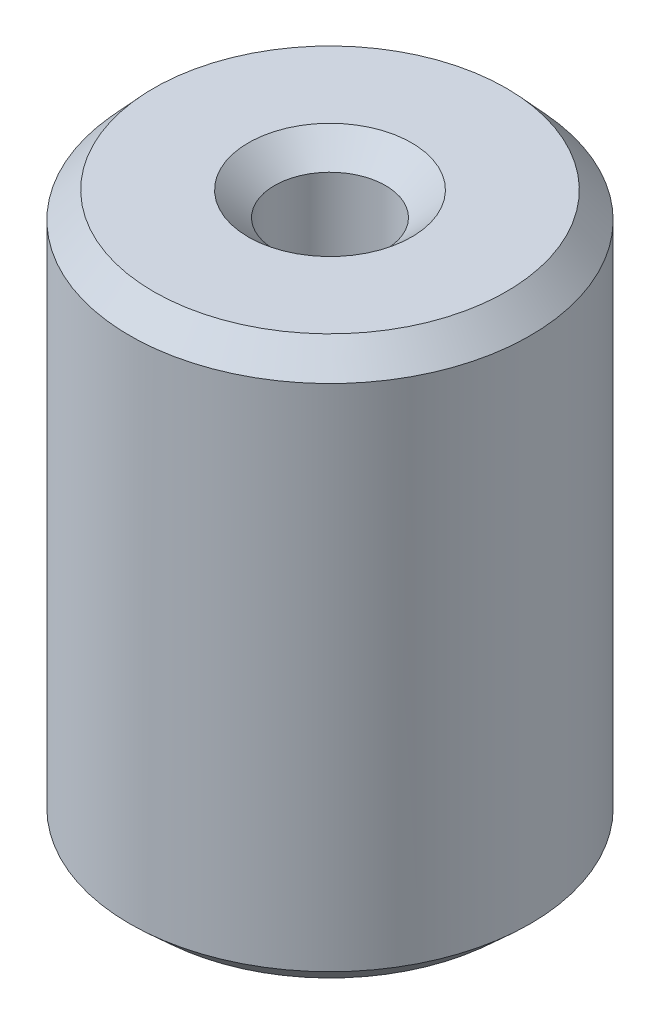
from build123d import *
from OCP.BRepFilletAPI import BRepFilletAPI_MakeChamfer

# Parameters (mm, degrees)
SKETCH1_R           = 5
BOSS_EXTRUDE1_DEPTH = 13.969813357
SKETCH2_R           = 1.386375293
CUT_EXTRUDE1_DEPTH  = 16.657448235
CHAMFER1_SIZE       = 0.652464638
CHAMFER1_SIZE2      = 0.597497914


with BuildPart() as part:
    # Sketch1 → Boss-Extrude1 (new body)
    with BuildSketch(Plane(origin=(0, 0, 0), x_dir=(1, 0, 0), z_dir=(0, 1, 0))):
        Circle(SKETCH1_R)
    extrude(amount=BOSS_EXTRUDE1_DEPTH)

    # Sketch2 → Cut-Extrude1 (cut, through all)
    with BuildSketch(Plane(origin=(0, 0, 0), x_dir=(1, 0, 0), z_dir=(0, 1, 0))):
        Circle(SKETCH2_R)
    extrude(amount=CUT_EXTRUDE1_DEPTH, mode=Mode.SUBTRACT)

    # Chamfer1: one chamfer whose edges measure the first distance from different faces: ONE call of the kernel's chamfer builder (chamfer() names one face for all edges)
    chamfer1_edges_1 = [part.edges().sort_by_distance(p)[0] for p in [
        (-1.386375293, 13.969813357, 0),
    ]]
    chamfer1_side_1 = [part.faces().sort_by_distance(p)[0] for p in [
        (-4.858578644, 13.969813357, 0),
    ]]
    chamfer1_edges_2 = [part.edges().sort_by_distance(p)[0] for p in [
        (-1.386375293, 0, 0),
    ]]
    chamfer1_side_2 = [part.faces().sort_by_distance(p)[0] for p in [
        (-1.386375293, 6.984906679, 0),
    ]]
    chamfer1_edges_3 = [part.edges().sort_by_distance(p)[0] for p in [
        (-5, 0, 0),
    ]]
    chamfer1_side_3 = [part.faces().sort_by_distance(p)[0] for p in [
        (-4.858578644, 0, 0),
    ]]
    chamfer1_edges_4 = [part.edges().sort_by_distance(p)[0] for p in [
        (-5, 13.969813357, 0),
    ]]
    chamfer1_side_4 = [part.faces().sort_by_distance(p)[0] for p in [
        (-5, 6.984906679, 0),
    ]]
    chamfer1 = BRepFilletAPI_MakeChamfer(part.part.solid().wrapped)
    for e in chamfer1_edges_1:
        chamfer1.Add(CHAMFER1_SIZE, CHAMFER1_SIZE2, e.wrapped, chamfer1_side_1[0].wrapped)  # the first distance lies on this face
    for e in chamfer1_edges_2:
        chamfer1.Add(CHAMFER1_SIZE, CHAMFER1_SIZE2, e.wrapped, chamfer1_side_2[0].wrapped)  # the first distance lies on this face
    for e in chamfer1_edges_3:
        chamfer1.Add(CHAMFER1_SIZE, CHAMFER1_SIZE2, e.wrapped, chamfer1_side_3[0].wrapped)  # the first distance lies on this face
    for e in chamfer1_edges_4:
        chamfer1.Add(CHAMFER1_SIZE, CHAMFER1_SIZE2, e.wrapped, chamfer1_side_4[0].wrapped)  # the first distance lies on this face
    add(Compound.cast(chamfer1.Shape()), mode=Mode.REPLACE)


solid = part.part
